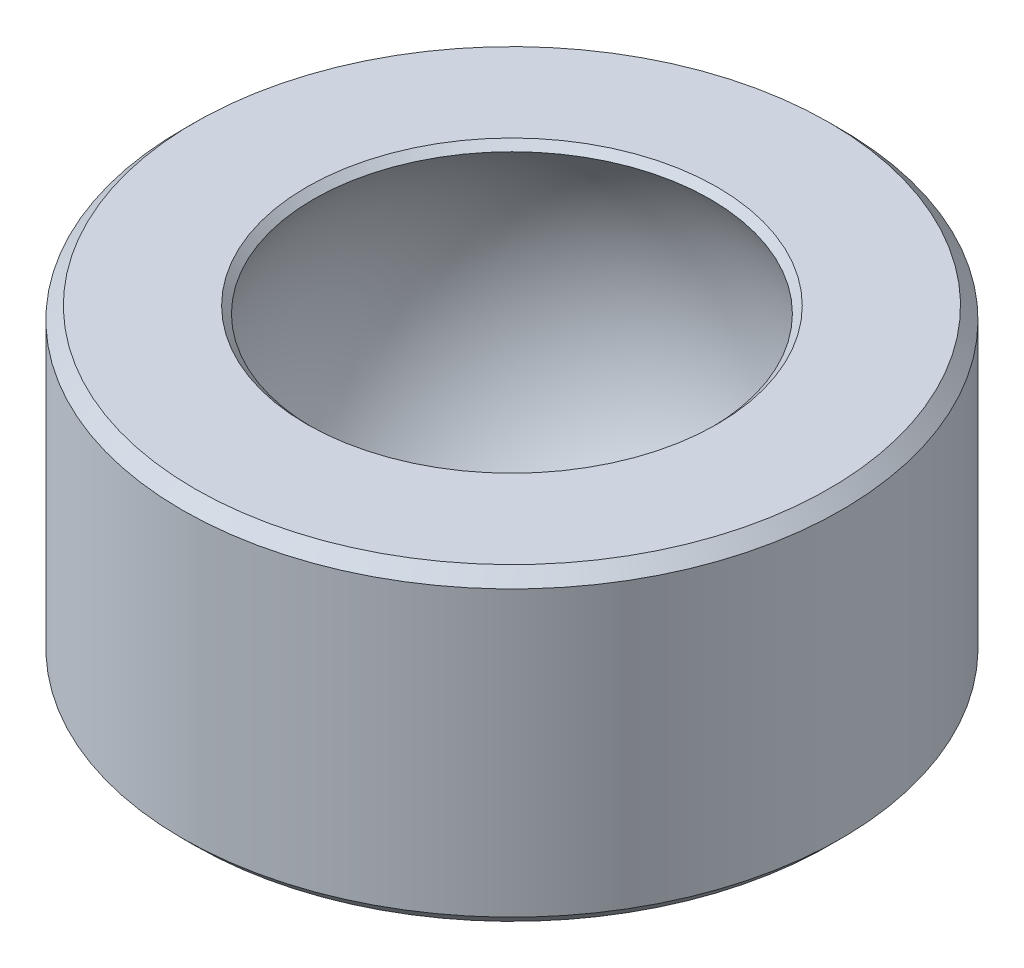
from build123d import *

# Parameters (mm, degrees)
BOSS_EXTRUDE1_DEPTH      = 1.875
BOSS_EXTRUDE1_DEPTH_BACK = 1.875
SKETCH1_R                = 4
SKETCH1_R_2              = 2
CHAMFER1_SIZE            = 0.106714114
CHAMFER1_SIZE_2          = 0.15


with BuildPart() as part:
    # Sketch1 → Boss-Extrude1 (new, two sides: drawn at the far end of the back side and taken through both)
    with BuildSketch(Plane(origin=(0, 0, 0), x_dir=(1, 0, 0), z_dir=(0, 1, 0)).offset(-BOSS_EXTRUDE1_DEPTH_BACK)):
        with Locations(Location((0, 0, 0), (0, 0, 270))):
            Circle(SKETCH1_R)
        with Locations(Location((0, 0, 0), (0, 0, 270))):
            Circle(SKETCH1_R_2, mode=Mode.SUBTRACT)
    extrude(amount=BOSS_EXTRUDE1_DEPTH + BOSS_EXTRUDE1_DEPTH_BACK)


with BuildPart() as body_2:
    # Sketch2 → Revolve1 (revolve)
    with BuildSketch(Plane(origin=(0, 0, 0), x_dir=(1, 0, 0), z_dir=(0, 1, 0))):
        with BuildLine():
            Line((0, 3), (0, -3))
            ThreePointArc((0, -3), (-3, 0), (0, 3))
        make_face()
    revolve(axis=Axis((0, 0, -3), (0, 0, 1)))


with BuildPart() as part_1:
    add(part.part)

    # Combine1: cut body 2
    add(body_2.part, mode=Mode.SUBTRACT)

    # Chamfer1
    # the kernel refuses this chamfer: 0.15, 0.106714114 mm, written as the material it takes off along each edge
    with BuildSketch(Plane(origin=(0, -1.875, 0), x_dir=(0, 0, 1), z_dir=(-1, 0, 0))) as chamfer1_piece_1:
        with BuildLine():
            Line((2.341874249 + CHAMFER1_SIZE * 1.00000000139, 0), (2.435009088, 0.122649938))
            ThreePointArc((2.435009088, 0.122649938), (2.390544922, 0.062461731), (2.341874249, 0))
            Line((2.341874249, 0), (2.341874249 + CHAMFER1_SIZE * 1.00000000139, 0))
        make_face()
    revolve(axis=Axis((0, -1.875, 0), (0, 1, 0)), mode=Mode.SUBTRACT)
    with BuildSketch(Plane(origin=(0, 1.875, 0), x_dir=(0, 0, 1), z_dir=(-1, 0, 0))) as chamfer1_piece_2:
        with BuildLine():
            Line((2.341874249 + CHAMFER1_SIZE_2, 0), (2.407214516, -0.084659733))
            ThreePointArc((2.407214516, -0.084659733), (2.375156045, -0.042342432), (2.341874249, 0))
            Line((2.341874249, 0), (2.341874249 + CHAMFER1_SIZE_2, 0))
        make_face()
    revolve(axis=Axis((0, 1.875, 0), (0, 1, 0)), mode=Mode.SUBTRACT)
    with BuildSketch(Plane(origin=(0, -1.875, 0), x_dir=(0, 0, 1), z_dir=(-1, 0, 0))) as chamfer1_piece_3:
        Polygon((4, CHAMFER1_SIZE_2), (4 - CHAMFER1_SIZE_2, 0), (4, 0), align=None)
    revolve(axis=Axis((0, -1.875, 0), (0, 1, 0)), mode=Mode.SUBTRACT)
    with BuildSketch(Plane(origin=(0, 1.875, 0), x_dir=(0, 0, 1), z_dir=(-1, 0, 0))) as chamfer1_piece_4:
        Polygon((4, -CHAMFER1_SIZE_2), (4 - CHAMFER1_SIZE_2, 0), (4, 0), align=None)
    revolve(axis=Axis((0, 1.875, 0), (0, 1, 0)), mode=Mode.SUBTRACT)


solid = part_1.part
